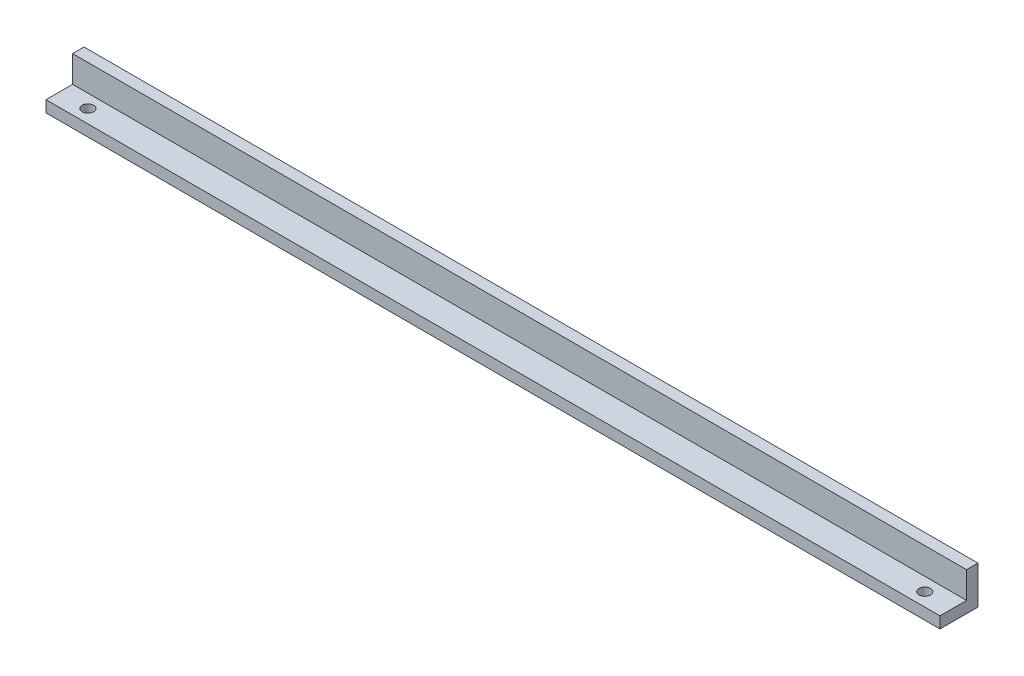
from build123d import *

# Parameters (mm, degrees)
EXTRUDE_1_DEPTH     = 235
SKETCH_3_R          = 1.5
CUT_EXTRUDE_1_DEPTH = 10


with BuildPart() as part:
    # Эскиз1 → Бобышка-Вытянуть1 (new body)
    with BuildSketch(Plane(origin=(0, 0, 0), x_dir=(0, 0, -1), z_dir=(1, 0, 0))):
        Polygon((0, 0), (-10, 0), (-10, 3), (-3, 3), (-3, 10), (0, 10), align=None)
    extrude(amount=EXTRUDE_1_DEPTH)

    # Эскиз3 → Вырез-Вытянуть1 (cut)
    with BuildSketch(Plane(origin=(0, 3, 0), x_dir=(1, 0, 0), z_dir=(0, 1, 0))):
        with Locations((7.5, -6.5)):
            Circle(SKETCH_3_R)
        with Locations((227.5, -6.5)):
            Circle(SKETCH_3_R)
    extrude(amount=-CUT_EXTRUDE_1_DEPTH, mode=Mode.SUBTRACT)


solid = part.part
